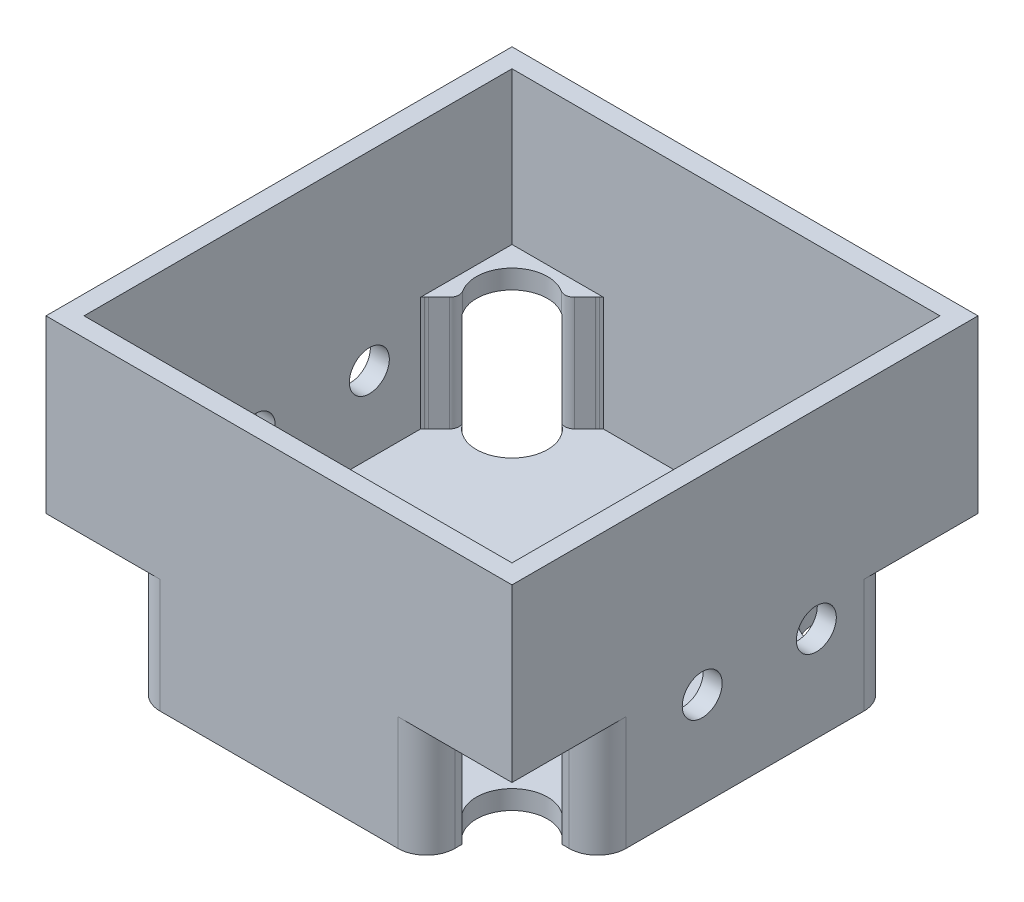
from build123d import *

# Parameters (mm, degrees)
EXTRUDE_1_DEPTH          = 12
EXTRUDE_START            = 2
EXTRUDE_2_DEPTH          = 2
SKETCH_2_W               = 49
SKETCH_2_H               = 49
SKETCH_2_W_2             = 45
SKETCH_2_H_2             = 45
EXTRUDE_3_DEPTH          = 16
EXTRUDE_4_DEPTH          = 2
SKETCH_5_R               = 2.25
CUT_EXTRUDE_2_DEPTH      = 46.831212072
SKETCH_7_R               = 3.75
CUT_EXTRUDE_3_DEPTH      = 46.831212072
CUT_EXTRUDE_4_DEPTH      = 60.943723608
CUT_EXTRUDE_4_DEPTH_BACK = 60.943723608
SKETCH_8_R               = 2.1
CUT_EXTRUDE_10_DEPTH     = 12
FILLET_2_R               = 1


with BuildPart() as part:
    # 草图3 → 凸台-拉伸1 (new body)
    with BuildSketch(Plane(origin=(0, 0, 0), x_dir=(-1, 0, 0), z_dir=(0, -1, 0))):
        with BuildLine():
            Line((18.5, 15.5), (21.5, 15.5))
            ThreePointArc((21.5, 15.5), (23.621320344, 14.621320344), (24.5, 12.5))
            Line((24.5, 12.5), (24.5, -12.5))
            ThreePointArc((24.5, -12.5), (23.621320344, -14.621320344), (21.5, -15.5))
            Line((21.5, -15.5), (18.5, -15.5))
            ThreePointArc((18.5, -15.5), (16.378679656, -16.378679656), (15.5, -18.5))
            Line((15.5, -18.5), (15.5, -21.5))
            ThreePointArc((15.5, -21.5), (14.621320344, -23.621320344), (12.5, -24.5))
            Line((12.5, -24.5), (-12.5, -24.5))
            ThreePointArc((-12.5, -24.5), (-14.621320344, -23.621320344), (-15.5, -21.5))
            Line((-15.5, -21.5), (-15.5, -18.5))
            ThreePointArc((-15.5, -18.5), (-16.378679656, -16.378679656), (-18.5, -15.5))
            Line((-18.5, -15.5), (-21.5, -15.5))
            ThreePointArc((-21.5, -15.5), (-23.621320344, -14.621320344), (-24.5, -12.5))
            Line((-24.5, -12.5), (-24.5, 12.5))
            ThreePointArc((-24.5, 12.5), (-23.621320344, 14.621320344), (-21.5, 15.5))
            Line((-21.5, 15.5), (-18.5, 15.5))
            ThreePointArc((-18.5, 15.5), (-16.378679656, 16.378679656), (-15.5, 18.5))
            Line((-15.5, 18.5), (-15.5, 21.5))
            ThreePointArc((-15.5, 21.5), (-14.621320344, 23.621320344), (-12.5, 24.5))
            Line((-12.5, 24.5), (12.5, 24.5))
            ThreePointArc((12.5, 24.5), (14.621320344, 23.621320344), (15.5, 21.5))
            Line((15.5, 21.5), (15.5, 18.5))
            ThreePointArc((15.5, 18.5), (16.378679656, 16.378679656), (18.5, 15.5))
        make_face()
        with BuildLine():
            Line((18.5, 13.5), (21.5, 13.5))
            ThreePointArc((21.5, 13.5), (22.207106781, 13.207106781), (22.5, 12.5))
            Line((22.5, 12.5), (22.5, -12.5))
            ThreePointArc((22.5, -12.5), (22.207106781, -13.207106781), (21.5, -13.5))
            Line((21.5, -13.5), (18.5, -13.5))
            ThreePointArc((18.5, -13.5), (14.964466094, -14.964466094), (13.5, -18.5))
            Line((13.5, -18.5), (13.5, -21.5))
            ThreePointArc((13.5, -21.5), (13.207106781, -22.207106781), (12.5, -22.5))
            Line((12.5, -22.5), (-12.5, -22.5))
            ThreePointArc((-12.5, -22.5), (-13.207106781, -22.207106781), (-13.5, -21.5))
            Line((-13.5, -21.5), (-13.5, -18.5))
            ThreePointArc((-13.5, -18.5), (-14.964466094, -14.964466094), (-18.5, -13.5))
            Line((-18.5, -13.5), (-21.5, -13.5))
            ThreePointArc((-21.5, -13.5), (-22.207106781, -13.207106781), (-22.5, -12.5))
            Line((-22.5, -12.5), (-22.5, 12.5))
            ThreePointArc((-22.5, 12.5), (-22.207106781, 13.207106781), (-21.5, 13.5))
            Line((-21.5, 13.5), (-18.5, 13.5))
            ThreePointArc((-18.5, 13.5), (-14.964466094, 14.964466094), (-13.5, 18.5))
            Line((-13.5, 18.5), (-13.5, 21.5))
            ThreePointArc((-13.5, 21.5), (-13.207106781, 22.207106781), (-12.5, 22.5))
            Line((-12.5, 22.5), (12.5, 22.5))
            ThreePointArc((12.5, 22.5), (13.207106781, 22.207106781), (13.5, 21.5))
            Line((13.5, 21.5), (13.5, 18.5))
            ThreePointArc((13.5, 18.5), (14.964466094, 14.964466094), (18.5, 13.5))
        make_face(mode=Mode.SUBTRACT)
    extrude(amount=-EXTRUDE_1_DEPTH)

    # 草图4 → 凸台-拉伸2 (add)
    with BuildSketch(Plane.XZ.offset(EXTRUDE_START)):
        with BuildLine():
            Line((-24.5, 12.5), (-24.5, -12.5))
            ThreePointArc((-24.5, -12.5), (-23.621320344, -14.621320344), (-21.5, -15.5))
            Line((-21.5, -15.5), (-18.5, -15.5))
            ThreePointArc((-18.5, -15.5), (-16.378679656, -16.378679656), (-15.5, -18.5))
            Line((-15.5, -18.5), (-15.5, -21.5))
            ThreePointArc((-15.5, -21.5), (-14.621320344, -23.621320344), (-12.5, -24.5))
            Line((-12.5, -24.5), (12.5, -24.5))
            ThreePointArc((12.5, -24.5), (14.621320344, -23.621320344), (15.5, -21.5))
            Line((15.5, -21.5), (15.5, -18.5))
            ThreePointArc((15.5, -18.5), (16.378679656, -16.378679656), (18.5, -15.5))
            Line((18.5, -15.5), (21.5, -15.5))
            ThreePointArc((21.5, -15.5), (23.621320344, -14.621320344), (24.5, -12.5))
            Line((24.5, -12.5), (24.5, 12.5))
            ThreePointArc((24.5, 12.5), (23.621320344, 14.621320344), (21.5, 15.5))
            Line((21.5, 15.5), (18.5, 15.5))
            ThreePointArc((18.5, 15.5), (16.378679656, 16.378679656), (15.5, 18.5))
            Line((15.5, 18.5), (15.5, 21.5))
            ThreePointArc((15.5, 21.5), (14.621320344, 23.621320344), (12.5, 24.5))
            Line((12.5, 24.5), (-12.5, 24.5))
            ThreePointArc((-12.5, 24.5), (-14.621320344, 23.621320344), (-15.5, 21.5))
            Line((-15.5, 21.5), (-15.5, 18.5))
            ThreePointArc((-15.5, 18.5), (-16.378679656, 16.378679656), (-18.5, 15.5))
            Line((-18.5, 15.5), (-21.5, 15.5))
            ThreePointArc((-21.5, 15.5), (-23.621320344, 14.621320344), (-24.5, 12.5))
        make_face()
    extrude(amount=-EXTRUDE_2_DEPTH)

    # 草图2 → 凸台-拉伸3 (add)
    with BuildSketch(Plane(origin=(0, 12, 0), x_dir=(1, 0, 0), z_dir=(0, 1, 0))):
        Rectangle(SKETCH_2_W, SKETCH_2_H)
        Rectangle(SKETCH_2_W_2, SKETCH_2_H_2, mode=Mode.SUBTRACT)
    extrude(amount=EXTRUDE_3_DEPTH)

    # 草图6 → 凸台-拉伸4 (add)
    with BuildSketch(Plane.XZ.offset(-12).offset(EXTRUDE_START)):
        with BuildLine():
            Line((12.5, 24.5), (24.5, 24.5))
            Line((24.5, 24.5), (24.5, 12.5))
            ThreePointArc((24.5, 12.5), (23.621320344, 14.621320344), (21.5, 15.5))
            Line((21.5, 15.5), (18.5, 15.5))
            ThreePointArc((18.5, 15.5), (16.378679656, 16.378679656), (15.5, 18.5))
            Line((15.5, 18.5), (15.5, 21.5))
            ThreePointArc((15.5, 21.5), (14.621320344, 23.621320344), (12.5, 24.5))
        make_face()
        with BuildLine():
            Line((-24.5, -12.5), (-24.5, -24.5))
            Line((-24.5, -24.5), (-12.5, -24.5))
            ThreePointArc((-12.5, -24.5), (-14.621320344, -23.621320344), (-15.5, -21.5))
            Line((-15.5, -21.5), (-15.5, -18.5))
            ThreePointArc((-15.5, -18.5), (-16.378679656, -16.378679656), (-18.5, -15.5))
            Line((-18.5, -15.5), (-21.5, -15.5))
            ThreePointArc((-21.5, -15.5), (-23.621320344, -14.621320344), (-24.5, -12.5))
        make_face()
        with BuildLine():
            Line((-24.5, 12.5), (-24.5, 24.5))
            Line((-24.5, 24.5), (-12.5, 24.5))
            ThreePointArc((-12.5, 24.5), (-14.621320344, 23.621320344), (-15.5, 21.5))
            Line((-15.5, 21.5), (-15.5, 18.5))
            ThreePointArc((-15.5, 18.5), (-16.378679656, 16.378679656), (-18.5, 15.5))
            Line((-18.5, 15.5), (-21.5, 15.5))
            ThreePointArc((-21.5, 15.5), (-23.621320344, 14.621320344), (-24.5, 12.5))
        make_face()
        with BuildLine():
            Line((12.5, -24.5), (24.5, -24.5))
            Line((24.5, -24.5), (24.5, -12.5))
            ThreePointArc((24.5, -12.5), (23.621320344, -14.621320344), (21.5, -15.5))
            Line((21.5, -15.5), (18.5, -15.5))
            ThreePointArc((18.5, -15.5), (16.378679656, -16.378679656), (15.5, -18.5))
            Line((15.5, -18.5), (15.5, -21.5))
            ThreePointArc((15.5, -21.5), (14.621320344, -23.621320344), (12.5, -24.5))
        make_face()
    extrude(amount=-EXTRUDE_4_DEPTH)

    # 草图5 → 切除-拉伸2 (cut, through all)
    with BuildSketch(Plane.XZ.offset(2)):
        with Locations(Location((-17.7, 17.7, 0), (0, 0, 270))):
            Circle(SKETCH_5_R)
        with Locations(Location((-17.7, -17.7, 0), (0, 0, 270))):
            Circle(SKETCH_5_R)
        with Locations(Location((17.7, 17.7, 0), (0, 0, 270))):
            Circle(SKETCH_5_R)
        with Locations(Location((17.7, -17.7, 0), (0, 0, 270))):
            Circle(SKETCH_5_R)
    extrude(amount=-CUT_EXTRUDE_2_DEPTH, mode=Mode.SUBTRACT)

    # 草图7 → 切除-拉伸3 (cut, through all)
    with BuildSketch(Plane.XZ.offset(2)):
        with Locations(Location((-17.7, 17.7, 0), (0, 0, 270))):
            Circle(SKETCH_7_R)
        with Locations(Location((-17.7, -17.7, 0), (0, 0, 270))):
            Circle(SKETCH_7_R)
        with Locations(Location((17.7, -17.7, 0), (0, 0, 270))):
            Circle(SKETCH_7_R)
        with Locations(Location((17.7, 17.7, 0), (0, 0, 270))):
            Circle(SKETCH_7_R)
    extrude(amount=-CUT_EXTRUDE_3_DEPTH, mode=Mode.SUBTRACT)

    # 草图8 → 切除-拉伸4 (cut, two sides: drawn at the far end of the back side and taken through both)
    with BuildSketch(Plane.ZY.offset(-22.5).offset(-CUT_EXTRUDE_4_DEPTH_BACK)):
        with Locations((-7.5, 8)):
            Circle(SKETCH_8_R)
        with Locations((4.5, 8)):
            Circle(SKETCH_8_R)
    extrude(amount=CUT_EXTRUDE_4_DEPTH + CUT_EXTRUDE_4_DEPTH_BACK, mode=Mode.SUBTRACT)

    # 草图15 → 切除-拉伸10 (cut)
    with BuildSketch(Plane(origin=(0, 12, 0), x_dir=(1, 0, 0), z_dir=(0, 1, 0))):
        Polygon((-22.5, 12.9), (-22.5, -12.9), (-17.7, -17.7), (-12.9, -22.5), (12.9, -22.5), (17.7, -17.7), (22.5, -12.9), (22.5, 12.9), (17.7, 17.7), (12.9, 22.5), (-12.9, 22.5), (-17.7, 17.7), align=None)
    extrude(amount=-CUT_EXTRUDE_10_DEPTH, mode=Mode.SUBTRACT)

    # 圆角2
    # the kernel refuses this fillet: 1 mm, written as the material it takes off along each edge
    with BuildSketch(Plane(origin=(-15.048349571, 14.233859763, 20.351650429), x_dir=(-0.7779866052155301, 0, 0.6282808624375049), z_dir=(0, -1, 0))) as fillet_2_piece_1:
        with BuildLine():
            CenterArc((0.89979254, -0.994381263), FILLET_2_R, 96.076598735, 77.846802531)
            Line((-0.094588722, -0.888523317), (0, 0))
            ThreePointArc((0, 0), (0.396967297, -0.021070265), (0.793934594, 0))
        make_face()
    extrude(amount=14.233859763, mode=Mode.SUBTRACT)
    with BuildSketch(Plane(origin=(-20.351650429, 14.233859763, 15.048349571), x_dir=(-0.7071067811865058, 0, -0.7071067811865893), z_dir=(0, -1, 0)), Plane(origin=(-15.048349571, 14.233859763, -20.351650429), x_dir=(0.7071067811865506, 0, -0.7071067811865446), z_dir=(0, -1, 0))) as fillet_2_piece_2:
        with BuildLine():
            CenterArc((0.893543905, -1), FILLET_2_R, 90, 77.846802531)
            ThreePointArc((-0.084044285, -0.789473684), (-0.021070265, -0.396967297), (0, 0))
            Line((0, 0), (0.893543905, 0))
        make_face()
    extrude(amount=14.233859763, mode=Mode.SUBTRACT)
    with BuildSketch(Plane(origin=(20.351650429, 14.233859763, 15.048349571), x_dir=(0.7071067811864988, 0, -0.7071067811865962), z_dir=(0, -1, 0)), Plane(origin=(-20.351650429, 14.233859763, -15.048349571), x_dir=(-0.7071067811865525, 0, 0.7071067811865426), z_dir=(0, -1, 0)), Plane(origin=(15.048349571, 14.233859763, -20.351650429), x_dir=(-0.7071067811865416, 0, -0.7071067811865536), z_dir=(0, -1, 0))) as fillet_2_piece_3:
        with BuildLine():
            CenterArc((0.893543905, 1), FILLET_2_R, 192.153197469, 77.846802531)
            ThreePointArc((-0.084044285, 0.789473684), (-0.021070265, 0.396967297), (0, 0))
            Line((0, 0), (0.893543905, 0))
        make_face()
    extrude(amount=14.233859763, mode=Mode.SUBTRACT)
    with BuildSketch(Plane(origin=(15.048349571, 14.233859763, 20.351650429), x_dir=(0.7779866052154646, 0, 0.6282808624375861), z_dir=(0, -1, 0)), Plane(origin=(20.351650429, 14.233859763, -15.048349571), x_dir=(0.628280862437575, 0, -0.7779866052154735), z_dir=(0, -1, 0))) as fillet_2_piece_4:
        with BuildLine():
            CenterArc((0.89979254, 0.994381263), FILLET_2_R, 186.076598734, 77.846802531)
            Line((-0.094588722, 0.888523317), (0, 0))
            ThreePointArc((0, 0), (0.396967297, 0.021070265), (0.793934594, 0))
        make_face()
    extrude(amount=14.233859763, mode=Mode.SUBTRACT)


solid = part.part
